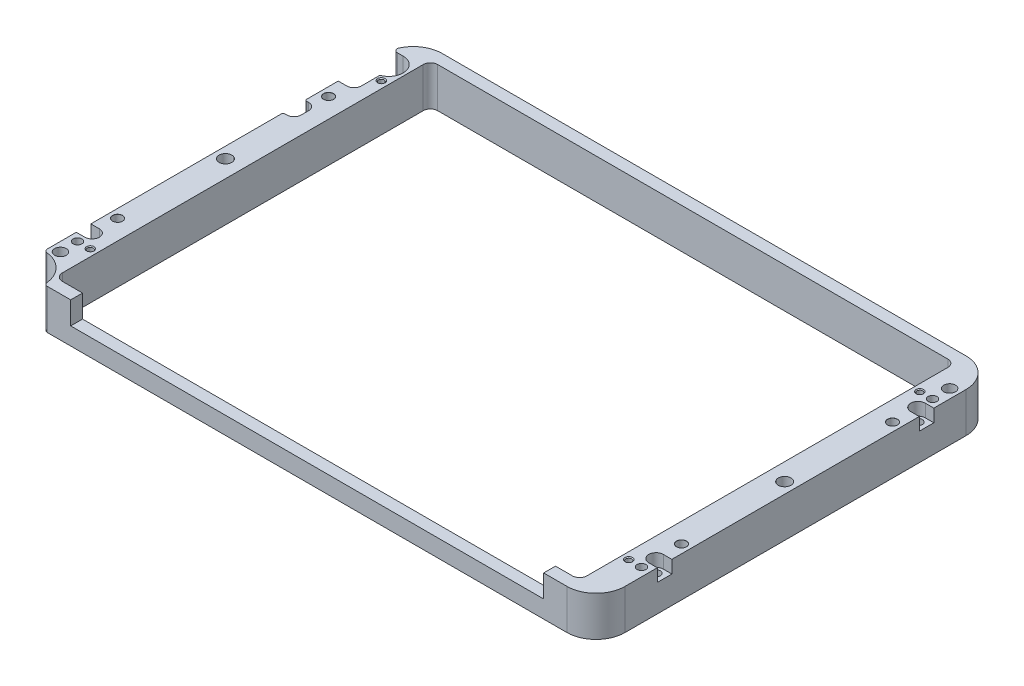
from build123d import *

# Parameters (mm, degrees)
SKETCH1_W                            = 159.7
SKETCH1_H                            = 109.7
SKETCH1_W_2                          = 144.2
SKETCH1_H_2                          = 103.2
BOSS_EXTRUDE1_DEPTH                  = 11
F_2_4_2_4_DIAMETER_HOLE1_D           = 2.4
CUT_EXTRUDE10_DEPTH                  = 3.5
LPATTERN1_COUNT                      = 2
LPATTERN1_PITCH                      = 72
MIRROR2_COPY_1_DEPTH                 = 3.5
M2X0_4_TAPPED_HOLE1_D                = 1.6
M2X0_4_TAPPED_HOLE1_DEPTH            = 3.5
M2X0_4_TAPPED_HOLE1_CSINK_D          = 2.05
M2X0_4_TAPPED_HOLE1_CSINK_ANGLE      = 90
M2X0_4_TAPPED_HOLE1_TIP              = 0.480688495
SKETCH11_W                           = 4.35
SKETCH11_H                           = 6
CUT_EXTRUDE4_DEPTH                   = 3.5
CUT_EXTRUDE11_DEPTH                  = 98.16375353
CUT_EXTRUDE11_DEPTH_BACK             = 98.16375353
F_2_4_2_4_DIAMETER_HOLE2_D           = 2.4
F_2_7_2_7_DIAMETER_HOLE1_D           = 2.7
F_2_7_2_7_DIAMETER_HOLE1_CSINK_D     = 2.75
F_2_7_2_7_DIAMETER_HOLE1_CSINK_ANGLE = 90
CUT_EXTRUDE6_DEPTH                   = 98.496384548
SKETCH19_R                           = 1.6
CUT_EXTRUDE7_DEPTH                   = 3.5
CUT_EXTRUDE8_DEPTH                   = 98.496384548
SKETCH8_R                            = 8
CUT_EXTRUDE9_DEPTH                   = 98.496384548
FILLET1_R                            = 2
FILLET2_R                            = 8
FILLET3_R                            = 1
FILLET4_R                            = 2
FILLET5_R                            = 0.5
CUT_EXTRUDE13_REACH                  = 138.129
SKETCH33_W                           = 130
SKETCH33_H                           = 6.2
SKETCH34_W                           = 4.2
SKETCH34_H                           = 4.2
CUT_EXTRUDE14_DEPTH                  = 2.5
MIRROR5_COPY_1_SKETCH_W              = 4.2
MIRROR5_COPY_1_SKETCH_H              = 4.2
MIRROR5_COPY_1_DEPTH                 = 2.5
SKETCH35_R                           = 1.75
CUT_EXTRUDE15_DEPTH                  = 4.5
SKETCH38_R                           = 1.25
CUT_EXTRUDE17_DEPTH                  = 98.091683475


with BuildPart() as part:
    # Sketch1 → Boss-Extrude1 (new body)
    with BuildSketch(Plane(origin=(0, 0, 0), x_dir=(1, 0, 0), z_dir=(0, 1, 0))):
        Rectangle(SKETCH1_W, SKETCH1_H)
        Rectangle(SKETCH1_W_2, SKETCH1_H_2, mode=Mode.SUBTRACT)
    extrude(amount=BOSS_EXTRUDE1_DEPTH)

    # Ø2.4 (2.4) Diameter Hole1 (through all)
    with Locations(Plane(origin=(0, 11, 0), x_dir=(1, 0, 0), z_dir=(0, 1, 0))):
        with Locations((-77.5, 36), (77.5, 36), (-77.5, -36), (77.5, -36)):
            Hole(F_2_4_2_4_DIAMETER_HOLE1_D / 2)

    # Sketch29 → Cut-Extrude10 (cut)
    with BuildSketch(Plane(origin=(0, 11, 0), x_dir=(1, 0, 0), z_dir=(0, 1, 0))):
        with BuildLine():
            Line((-77.5, 38), (-79.85, 38))
            Line((-79.85, 38), (-79.85, 34))
            Line((-79.85, 34), (-77.5, 34))
            ThreePointArc((-77.5, 34), (-75.5, 36), (-77.5, 38))
        make_face()
    cut_extrude10 = extrude(amount=-CUT_EXTRUDE10_DEPTH, mode=Mode.SUBTRACT)

    # LPattern1: Cut-Extrude10 ×2
    with Locations(*[(0, 0, i * LPATTERN1_PITCH) for i in range(1, LPATTERN1_COUNT)]):
        add(cut_extrude10, mode=Mode.SUBTRACT)

    # Mirror2: Cut-Extrude10 across plane
    add(cut_extrude10.mirror(Plane(origin=(0, 0, 0), x_dir=(0, 0, 1), z_dir=(1, 0, 0))), mode=Mode.SUBTRACT)

    # Mirror2 copy 1 sketch → Mirror2 copy 1 (cut)
    with BuildSketch(Plane(origin=(0, 11, 72), x_dir=(-1, 0, 0), z_dir=(0, 1, 0))):
        with BuildLine():
            Line((-77.5, -38), (-79.85, -38))
            Line((-79.85, -38), (-79.85, -34))
            Line((-79.85, -34), (-77.5, -34))
            ThreePointArc((-77.5, -34), (-75.5, -36), (-77.5, -38))
        make_face()
    extrude(amount=-MIRROR2_COPY_1_DEPTH, mode=Mode.SUBTRACT)

    # M2x0.4 Tapped Hole1
    with Locations(Plane(origin=(0, 11, 0), x_dir=(1, 0, 0), z_dir=(0, 1, 0))):
        with Locations((-74, 40), (-74, -40), (74, 40), (74, -40)):
            CounterSinkHole(M2X0_4_TAPPED_HOLE1_D / 2, M2X0_4_TAPPED_HOLE1_CSINK_D / 2, depth=M2X0_4_TAPPED_HOLE1_DEPTH, counter_sink_angle=M2X0_4_TAPPED_HOLE1_CSINK_ANGLE)
            with Locations((0, 0, -(M2X0_4_TAPPED_HOLE1_DEPTH + M2X0_4_TAPPED_HOLE1_TIP / 2))):  # 118° drill point
                Cone(0, M2X0_4_TAPPED_HOLE1_D / 2, M2X0_4_TAPPED_HOLE1_TIP, mode=Mode.SUBTRACT)

    # Sketch11 → Cut-Extrude4 (cut)
    with BuildSketch(Plane(origin=(0, 11, 0), x_dir=(1, 0, 0), z_dir=(0, 1, 0))):
        with Locations((-77.675, 39)):
            Rectangle(SKETCH11_W, SKETCH11_H)
    extrude(amount=-CUT_EXTRUDE4_DEPTH, mode=Mode.SUBTRACT)

    # Sketch30 → Cut-Extrude11 (cut, two sides: drawn at the far end of the back side and taken through both)
    with BuildSketch(Plane(origin=(0, 7.5, 0), x_dir=(1, 0, 0), z_dir=(0, 1, 0)).offset(-CUT_EXTRUDE11_DEPTH_BACK)):
        with BuildLine():
            Line((-75.5, 40), (-75.5, 42))
            Line((-75.5, 42), (-79.85, 42))
            Line((-79.85, 42), (-79.85, 38))
            Line((-79.85, 38), (-77.5, 38))
            ThreePointArc((-77.5, 38), (-76.085786438, 38.585786438), (-75.5, 40))
        make_face()
    extrude(amount=CUT_EXTRUDE11_DEPTH + CUT_EXTRUDE11_DEPTH_BACK, mode=Mode.SUBTRACT)

    # Ø2.4 (2.4) Diameter Hole2 (through all)
    with Locations(Plane(origin=(0, 11, 0), x_dir=(1, 0, 0), z_dir=(0, 1, 0))):
        with Locations((-77.5, -40), (77.5, 40), (77.5, -40)):
            Hole(F_2_4_2_4_DIAMETER_HOLE2_D / 2)

    # Ø2.7 (2.7) Diameter Hole1 (through all)
    with Locations(Plane(origin=(0, 11, 0), x_dir=(1, 0, 0), z_dir=(0, 1, 0))):
        with Locations((-77.5, 29), (-77.5, -29), (77.5, 29), (77.5, -29)):
            CounterSinkHole(F_2_7_2_7_DIAMETER_HOLE1_D / 2, F_2_7_2_7_DIAMETER_HOLE1_CSINK_D / 2, counter_sink_angle=F_2_7_2_7_DIAMETER_HOLE1_CSINK_ANGLE)

    # Sketch18 → Cut-Extrude6 (cut, through all)
    with BuildSketch(Plane(origin=(0, 11, 0), x_dir=(1, 0, 0), z_dir=(0, 1, 0))):
        with BuildLine():
            Line((-78.85, 24.85), (-79.85, 24.85))
            Line((-79.85, 24.85), (-79.85, 18.85))
            Line((-79.85, 18.85), (-78.85, 18.85))
            ThreePointArc((-78.85, 18.85), (-77.435786438, 19.435786438), (-76.85, 20.85))
            Line((-76.85, 20.85), (-76.85, 22.85))
            ThreePointArc((-76.85, 22.85), (-77.435786438, 24.264213562), (-78.85, 24.85))
        make_face()
    extrude(amount=-CUT_EXTRUDE6_DEPTH, mode=Mode.SUBTRACT)

    # Sketch19 → Cut-Extrude7 (cut)
    with BuildSketch(Plane(origin=(0, 11, 0), x_dir=(1, 0, 0), z_dir=(0, 1, 0))):
        with Locations(Location((77.35, 44.85, 0), (0, 0, 270))):
            Circle(SKETCH19_R)
        with Locations(Location((-77.35, -44.85, 0), (0, 0, 270))):
            Circle(SKETCH19_R)
    extrude(amount=-CUT_EXTRUDE7_DEPTH, mode=Mode.SUBTRACT)

    # Sketch7 → Cut-Extrude8 (cut, through all)
    with BuildSketch(Plane(origin=(0, 11, 0), x_dir=(1, 0, 0), z_dir=(0, 1, 0))):
        with BuildLine():
            Line((-76.85, 48.85), (-79.85, 48.85))
            Line((-79.85, 48.85), (-79.85, 40.85))
            Line((-79.85, 40.85), (-76.85, 40.85))
            ThreePointArc((-76.85, 40.85), (-72.85, 44.85), (-76.85, 48.85))
        make_face()
    extrude(amount=-CUT_EXTRUDE8_DEPTH, mode=Mode.SUBTRACT)

    # Sketch8 → Cut-Extrude9 (cut, through all)
    with BuildSketch(Plane(origin=(0, 11, 0), x_dir=(1, 0, 0), z_dir=(0, 1, 0))):
        with Locations((-79.85, -54.85)):
            Circle(SKETCH8_R)
    extrude(amount=-CUT_EXTRUDE9_DEPTH, mode=Mode.SUBTRACT)

    # Fillet1
    fillet1_edges = [part.edges().sort_by_distance(p)[0] for p in [
        (72.1, 5.5, 51.6),
        (72.1, 5.5, -51.6),
        (-72.1, 5.5, -51.6),
        (-72.1, 5.5, 51.6),
    ]]
    fillet(fillet1_edges, radius=FILLET1_R)

    # Fillet2
    # the kernel refuses this fillet: 8 mm, written as the material it takes off along each edge
    with BuildSketch(Plane(origin=(79.85, -20, 54.85), x_dir=(-1, 0, 0), z_dir=(0, 1, 0)), Plane(origin=(79.85, -20, -54.85), x_dir=(0, 0, 1), z_dir=(0, 1, 0))) as fillet2_piece_1:
        with BuildLine():
            CenterArc((FILLET2_R, -FILLET2_R), FILLET2_R, 90, 90)
            Line((0, -FILLET2_R), (-FILLET2_R * 0.02, -FILLET2_R))
            Line((-FILLET2_R * 0.02, -FILLET2_R), (-FILLET2_R * 0.02, FILLET2_R * 0.02))
            Line((-FILLET2_R * 0.02, FILLET2_R * 0.02), (FILLET2_R, FILLET2_R * 0.02))
            Line((FILLET2_R, FILLET2_R * 0.02), (FILLET2_R, 0))
        make_face()
    extrude(amount=51, mode=Mode.SUBTRACT)
    with BuildSketch(Plane(origin=(-79.85, -19.364916731, -54.85), x_dir=(1, 0, 0), z_dir=(0, 1, 0))) as fillet2_piece_2:
        with BuildLine():
            CenterArc((7.745966692, -8), FILLET2_R, 90, 75.522487814)
            Line((0, -6), (-0.154919334, -5.96))
            ThreePointArc((-0.154919334, -5.96), (-0.16, -3), (-0.16, 0))
            Line((-0.16, 0), (0, 0.16))
            Line((0, 0.16), (7.745966692, 0.16))
            Line((7.745966692, 0.16), (7.745966692, 0))
        make_face()
    extrude(amount=49.729833462, mode=Mode.SUBTRACT)

    # Fillet3
    fillet3_edges = [part.edges().sort_by_distance(p)[0] for p in [
        (-79.85, 5.5, -48.85),
        (-71.85, 5.5, 54.85),
        (-79.85, 5.5, 46.85),
    ]]
    fillet(fillet3_edges, radius=FILLET3_R)

    # Fillet4
    fillet4_edges = [part.edges().sort_by_distance(p)[0] for p in [
        (-79.85, 3.75, -38),
    ]]
    fillet(fillet4_edges, radius=FILLET4_R)

    # Fillet5
    fillet5_edges = [part.edges().sort_by_distance(p)[0] for p in [
        (-79.85, 5.5, -18.85),
        (-79.85, 5.5, -24.85),
    ]]
    fillet(fillet5_edges, radius=FILLET5_R)

    # Sketch33 → Cut-Extrude13 (cut, up to next)
    with BuildSketch(Plane.XY.offset(54.85), mode=Mode.PRIVATE) as cut_extrude13_sk1:
        with Locations((0.472135955, 7.9)):
            Rectangle(SKETCH33_W, SKETCH33_H)
    cut_extrude13_tool1 = extrude(cut_extrude13_sk1.sketch, amount=-CUT_EXTRUDE13_REACH, mode=Mode.PRIVATE) & part.part
    add(cut_extrude13_tool1.solids().sort_by_distance((0.472136, 7.9, 54.85))[0], mode=Mode.SUBTRACT)

    # Sketch34 → Cut-Extrude14 (cut)
    with BuildSketch(Plane(origin=(0, 0, 0), x_dir=(-1, 0, 0), z_dir=(0, -1, 0))):
        with Locations((-77.5, -29)):
            Rectangle(SKETCH34_W, SKETCH34_H)
    cut_extrude14 = extrude(amount=-CUT_EXTRUDE14_DEPTH, mode=Mode.SUBTRACT)

    # Mirror4: Cut-Extrude14 across plane
    add(cut_extrude14.mirror(Plane.XY), mode=Mode.SUBTRACT)

    # Mirror5: Cut-Extrude14 across plane
    add(cut_extrude14.mirror(Plane(origin=(0, 0, 0), x_dir=(0, 0, 1), z_dir=(1, 0, 0))), mode=Mode.SUBTRACT)

    # Mirror5 copy 1 sketch → Mirror5 copy 1 (cut)
    with BuildSketch(Plane.XZ):
        with Locations((-77.5, -29)):
            Rectangle(MIRROR5_COPY_1_SKETCH_W, MIRROR5_COPY_1_SKETCH_H)
    extrude(amount=-MIRROR5_COPY_1_DEPTH, mode=Mode.SUBTRACT)

    # Sketch35 → Cut-Extrude15 (cut)
    with BuildSketch(Plane(origin=(0, 11, 0), x_dir=(1, 0, 0), z_dir=(0, 1, 0))):
        with Locations(Location((-76.85, 0, 0), (0, 0, 270))):
            Circle(SKETCH35_R)
    cut_extrude15 = extrude(amount=-CUT_EXTRUDE15_DEPTH, mode=Mode.SUBTRACT)

    # Sketch38 → Cut-Extrude17 (cut, through all)
    with BuildSketch(Plane(origin=(0, 6.5, 0), x_dir=(1, 0, 0), z_dir=(0, 1, 0))):
        with Locations(Location((-76.85, 0, 0), (0, 0, 270))):
            Circle(SKETCH38_R)
    cut_extrude17 = extrude(amount=-CUT_EXTRUDE17_DEPTH, mode=Mode.SUBTRACT)

    # Mirror7: Cut-Extrude15, Cut-Extrude17 across plane
    add(cut_extrude15.mirror(Plane(origin=(0, 0, 0), x_dir=(0, 0, 1), z_dir=(1, 0, 0))), mode=Mode.SUBTRACT)
    add(cut_extrude17.mirror(Plane(origin=(0, 0, 0), x_dir=(0, 0, 1), z_dir=(1, 0, 0))), mode=Mode.SUBTRACT)


solid = part.part
